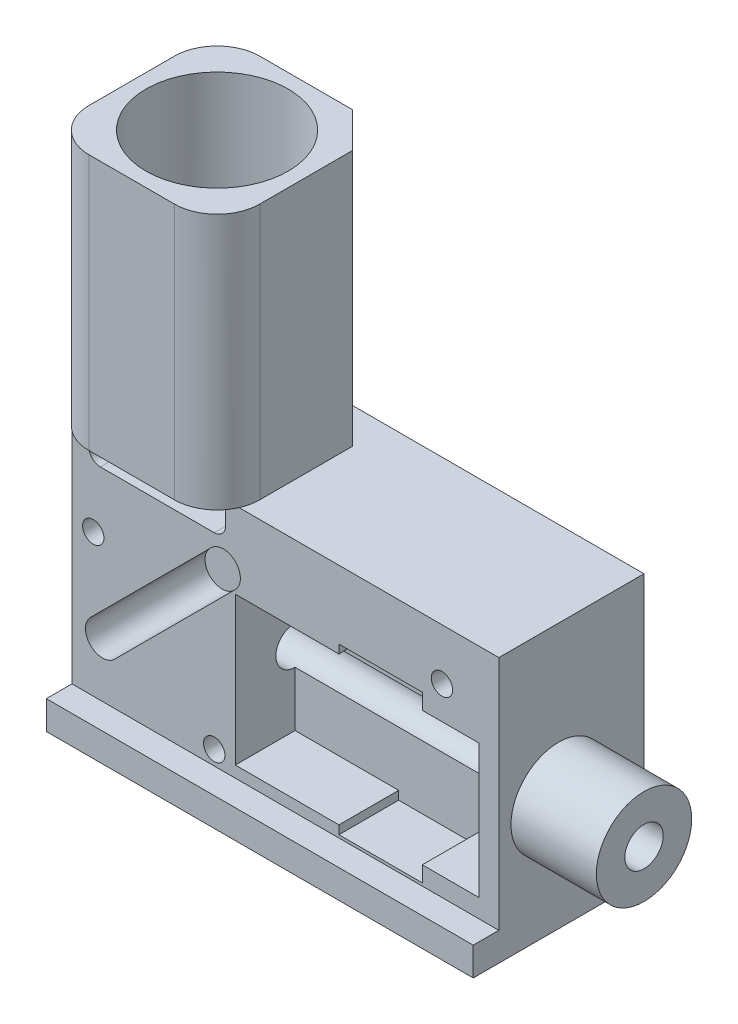
from build123d import *

# Parameters (mm, degrees)
SKETCH1_W                       = 15
SKETCH1_H                       = 6
MAIN_BODY_EXT_DEPTH             = 9.3
EMISSION_PATH_EXT_DEPTH         = 9
SKETCH3_R                       = 1.25
EMISSION_AND_GRIN_CUT_DEPTH     = 21.003499694
FIBER_FERRULE_CUT_REACH         = 25.851
FIBER_FERRULE_CUT_END_RADIUS    = 1.25
SKETCH4_R                       = 0.675
FIBER_START                     = 3
SKETCH41_R                      = 1.675
SKETCH41_R_2                    = 0.675
FIBER_FERRULE_PORT_EXT_DEPTH    = 3
SKETCH5_W                       = 15
SKETCH5_H                       = 8.3
FILTERSET_CUT1_DEPTH            = 0.9
FILTERSET_CUT2_DEPTH            = 4.2
SKETCH10_R                      = 2.5
EMISSION_LENS_CUT_DEPTH         = 8.5
EXCITATION_PATHWAY_CUT_2_DEPTH  = 2.1
SKETCH15_R                      = 0.795
MAGNETS_CUT_DEPTH               = 0.9
SCREW_HOLES_CUT_DEPTH           = 22.705990005
SCREW_HOLES_CUT_DEPTH_BACK      = 3
SKETCH18_R                      = 0.375
EXTERNAL_FILLET_1_R             = 1.5
EMISSION_PATHWAY_CUT_DEPTH      = 15.942891357
EMISSION_PATHWAY_CUT_DEPTH_BACK = 4
SKETCH28_R                      = 1.5
CUT_EXTRUDE16_DEPTH             = 9
CUT_EXTRUDE17_REACH             = 16.673
SKETCH37_R                      = 2
BASEPLATE_NOTCH_CUT_DEPTH       = 22.310560811
BASEPLATE_NOTCH_CUT_DEPTH_BACK  = 2


with BuildPart() as part:
    # Sketch1 → Main Body Ext (new body)
    with BuildSketch(Plane(origin=(0, 0, 0), x_dir=(1, 0, 0), z_dir=(0, 1, 0))):
        Rectangle(SKETCH1_W, SKETCH1_H)
    extrude(amount=MAIN_BODY_EXT_DEPTH)

    # Sketch8 → Emission Path Ext (add)
    with BuildSketch(Plane(origin=(0, 9.3, 0), x_dir=(1, 0, 0), z_dir=(0, 1, 0))):
        Polygon((-2.75, 3), (-1.5, 1.75), (-1.5, -3), (-7.5, -3), (-7.5, 3), align=None)
    extrude(amount=EMISSION_PATH_EXT_DEPTH)

    # Sketch3 → Emission and Grin Cut (cut, through all)
    with BuildSketch(Plane.XZ):
        with Locations(Location((-4.5, 0, 0), (0, 0, 270))):
            Circle(SKETCH3_R)
    extrude(amount=-EMISSION_AND_GRIN_CUT_DEPTH, mode=Mode.SUBTRACT)

    # Fiber Ferrule Cut: up to this cylinder (the profile starts outside it)
    fiber_ferrule_cut_end = Plane(origin=(-4.5, 4, 0), z_dir=(0, -1, 0)) * Cylinder(FIBER_FERRULE_CUT_END_RADIUS, 55.202, mode=Mode.PRIVATE)
    # Sketch4 → Fiber Ferrule Cut (cut, up to the surface)
    with BuildSketch(Plane(origin=(7.5, 0, 0), x_dir=(0, 0, -1), z_dir=(1, 0, 0)), mode=Mode.PRIVATE) as fiber_ferrule_cut_sk1:
        with Locations((0, 4)):
            Circle(SKETCH4_R)
    fiber_ferrule_cut_tool1 = extrude(fiber_ferrule_cut_sk1.sketch, amount=-FIBER_FERRULE_CUT_REACH, mode=Mode.PRIVATE) - fiber_ferrule_cut_end
    add(fiber_ferrule_cut_tool1.solids().sort_by_distance((7.5, 4, 0))[0], mode=Mode.SUBTRACT)

    # Sketch41 → Fiber Ferrule Port Ext (add)
    with BuildSketch(Plane(origin=(7.5, 0, 0), x_dir=(0, 0, -1), z_dir=(1, 0, 0)).offset(FIBER_START)):
        with Locations(Location((0, 4, 0), (0, 0, 180))):
            Circle(SKETCH41_R)
        with Locations((0, 4)):
            Circle(SKETCH41_R_2, mode=Mode.SUBTRACT)
    extrude(amount=-FIBER_FERRULE_PORT_EXT_DEPTH)

    # Sketch5 → FilterSet Cut1 (cut)
    with BuildSketch(Plane.XY.offset(3)):
        with Locations((0, 5.15)):
            Rectangle(SKETCH5_W, SKETCH5_H)
    extrude(amount=-FILTERSET_CUT1_DEPTH, mode=Mode.SUBTRACT)

    # Sketch6 → FilterSet Cut2 (cut)
    with BuildSketch(Plane.XY.offset(2.1)):
        with BuildLine():
            Line((-2.60588745, 7.591168825), (-6.848528137, 3.348528137))
            ThreePointArc((-6.848528137, 3.348528137), (-6.848528137, 2.5), (-6, 2.5))
            Line((-6, 2.5), (-1.757359313, 6.742640687))
            ThreePointArc((-1.757359313, 6.742640687), (-1.757359313, 7.591168825), (-2.60588745, 7.591168825))
        make_face()
        with BuildLine():
            ThreePointArc((-6.5, 9.3), (-6.782842712, 9.182842712), (-6.9, 8.9))
            Line((-6.9, 8.9), (-6.9, 8.5))
            ThreePointArc((-6.9, 8.5), (-6.782842712, 8.217157288), (-6.5, 8.1))
            Line((-6.5, 8.1), (-2.5, 8.1))
            ThreePointArc((-2.5, 8.1), (-2.217157288, 8.217157288), (-2.1, 8.5))
            Line((-2.1, 8.5), (-2.1, 8.9))
            ThreePointArc((-2.1, 8.9), (-2.217157288, 9.182842712), (-2.5, 9.3))
            Line((-2.5, 9.3), (-6.5, 9.3))
        make_face()
    extrude(amount=-FILTERSET_CUT2_DEPTH, mode=Mode.SUBTRACT)

    # Sketch10 → Emission Lens Cut (cut)
    with BuildSketch(Plane(origin=(0, 18.3, 0), x_dir=(1, 0, 0), z_dir=(0, 1, 0))):
        with Locations(Location((-4.5, 0, 0), (0, 0, 270))):
            Circle(SKETCH10_R)
    extrude(amount=-EMISSION_LENS_CUT_DEPTH, mode=Mode.SUBTRACT)

    # Sketch44 → Excitation Pathway Cut 2 (cut)
    with BuildSketch(Plane.XY):
        Polygon((3.4, 1.1), (1.88, 1.1), (1.88, 1.4), (0.6, 1.4), (-0.9, 1.4), (-1.76, 1.4), (-1.76, 6.6), (-0.9, 6.6), (0.6, 6.6), (1.88, 6.6), (1.88, 6.9), (3.4, 6.9), (4.81, 6.9), (4.81, 6.35), (6.81, 6.35), (6.81, 1.65), (4.81, 1.65), (4.81, 1.1), align=None)
    extrude(amount=EXCITATION_PATHWAY_CUT_2_DEPTH, mode=Mode.SUBTRACT)

    # Sketch15 → Magnets Cut (cut)
    with BuildSketch(Plane.XZ):
        with Locations(Location((-6.25, -1.875, 0), (0, 0, 270))):
            Circle(SKETCH15_R)
        with Locations(Location((-6.25, 1.875, 0), (0, 0, 270))):
            Circle(SKETCH15_R)
        with Locations(Location((-1.5, 0, 0), (0, 0, 270))):
            Circle(SKETCH15_R)
    extrude(amount=-MAGNETS_CUT_DEPTH, mode=Mode.SUBTRACT)

    # Sketch18 → Screw Holes Cut (cut, two sides: drawn at the far end of the back side and taken through both)
    with BuildSketch(Plane.XY.offset(2.1).offset(-SCREW_HOLES_CUT_DEPTH_BACK)):
        with Locations(Location((-6.75, 6, 0), (0, 0, 180))):
            Circle(SKETCH18_R)
        with Locations(Location((5.5, 7.5, 0), (0, 0, 180))):
            Circle(SKETCH18_R)
        with Locations(Location((-2.5, 1.51, 0), (0, 0, 180))):
            Circle(SKETCH18_R)
    extrude(amount=SCREW_HOLES_CUT_DEPTH + SCREW_HOLES_CUT_DEPTH_BACK, mode=Mode.SUBTRACT)

    # External Fillet 1
    # the kernel refuses this fillet: 1.5 mm, written as the material it takes off along each edge
    with BuildSketch(Plane(origin=(-7.5, -3.75, -3), x_dir=(1, 0, 0), z_dir=(0, 1, 0))) as external_fillet_1_piece_1:
        with BuildLine():
            CenterArc((EXTERNAL_FILLET_1_R, -EXTERNAL_FILLET_1_R), EXTERNAL_FILLET_1_R, 90, 90)
            Line((0, -EXTERNAL_FILLET_1_R), (0, 0))
            Line((0, 0), (EXTERNAL_FILLET_1_R, 0))
        make_face()
    extrude(amount=25.8, mode=Mode.SUBTRACT)
    with BuildSketch(Plane(origin=(-1.5, 9.3, 3), x_dir=(0, 0, -1), z_dir=(0, 1, 0))) as external_fillet_1_piece_2:
        with BuildLine():
            CenterArc((EXTERNAL_FILLET_1_R, EXTERNAL_FILLET_1_R), EXTERNAL_FILLET_1_R, 180, 90)
            Line((0, EXTERNAL_FILLET_1_R), (0, 0))
            Line((0, 0), (EXTERNAL_FILLET_1_R, 0))
        make_face()
    extrude(amount=12.75, mode=Mode.SUBTRACT)

    # Sketch28 → Emission Pathway Cut (cut, two sides: drawn at the far end of the back side and taken through both)
    with BuildSketch(Plane(origin=(0, 8.1, 0), x_dir=(1, 0, 0), z_dir=(0, 1, 0)).offset(-EMISSION_PATHWAY_CUT_DEPTH_BACK)):
        with Locations(Location((-4.5, 0, 0), (0, 0, 180))):
            Circle(SKETCH28_R)
    extrude(amount=EMISSION_PATHWAY_CUT_DEPTH + EMISSION_PATHWAY_CUT_DEPTH_BACK, mode=Mode.SUBTRACT)

    # Sketch36 → Cut-Extrude16 (cut)
    with BuildSketch(Plane(origin=(0, 18.3, 0), x_dir=(1, 0, 0), z_dir=(0, 1, 0))):
        with BuildLine():
            Line((-7.5, -1.5), (-7.5, -3))
            Line((-7.5, -3), (-6, -3))
            ThreePointArc((-6, -3), (-7.060660172, -2.560660172), (-7.5, -1.5))
        make_face()
    extrude(amount=-CUT_EXTRUDE16_DEPTH, mode=Mode.SUBTRACT)

    # Sketch37 → Cut-Extrude17 (cut, up to next)
    with BuildSketch(Plane(origin=(0, 9.8, 0), x_dir=(1, 0, 0), z_dir=(0, 1, 0)), mode=Mode.PRIVATE) as cut_extrude17_sk1:
        with Locations(Location((-4.5, 0, 0), (0, 0, 180))):
            Circle(SKETCH37_R)
    cut_extrude17_tool1 = extrude(cut_extrude17_sk1.sketch, amount=-CUT_EXTRUDE17_REACH, mode=Mode.PRIVATE) & part.part
    add(cut_extrude17_tool1.solids().sort_by_distance((-4.5, 9.8, 0))[0], mode=Mode.SUBTRACT)

    # Sketch45 → Baseplate Notch Cut (cut, two sides: drawn at the far end of the back side and taken through both)
    with BuildSketch(Plane.XZ.offset(-BASEPLATE_NOTCH_CUT_DEPTH_BACK)):
        Polygon((30.47380128, 32.796887648), (7.5, -1.663902268), (6.609270453, -3), (-16.364530827, -37.460789916), (52.557049005, -83.408392475), (99.395381111, -13.150714911), align=None)
    extrude(amount=BASEPLATE_NOTCH_CUT_DEPTH + BASEPLATE_NOTCH_CUT_DEPTH_BACK, mode=Mode.SUBTRACT)


solid = part.part
